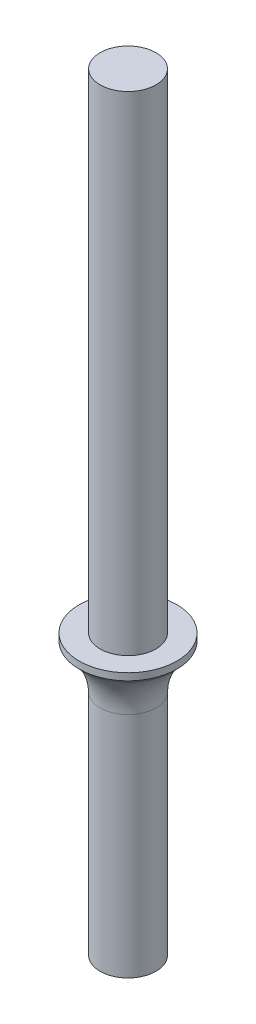
from build123d import *

# Parameters (mm, degrees)
SKETCH1_R           = 4
BOSS_EXTRUDE1_DEPTH = 110
SKETCH2_R           = 7
BOSS_EXTRUDE2_DEPTH = 1
CHAMFER1_SIZE       = 3
FILLET1_R           = 8


with BuildPart() as part:
    # Sketch1 → Boss-Extrude1 (new body)
    with BuildSketch(Plane(origin=(0, 0, 0), x_dir=(1, 0, 0), z_dir=(0, 1, 0))):
        with Locations(Location((0, 0, 0), (0, 0, 270))):
            Circle(SKETCH1_R)
    extrude(amount=BOSS_EXTRUDE1_DEPTH)

    # Sketch2 → Boss-Extrude2 (add)
    with BuildSketch(Plane(origin=(0, 39, 0), x_dir=(-1, 0, 0), z_dir=(0, -1, 0))):
        with Locations(Location((0, 0, 0), (0, 0, 90))):
            Circle(SKETCH2_R)
    extrude(amount=-BOSS_EXTRUDE2_DEPTH)

    # Chamfer1
    chamfer1_edges = [part.edges().sort_by_distance(p)[0] for p in [
        (0, 39, -4),
    ]]
    chamfer(chamfer1_edges, length=CHAMFER1_SIZE - 0.0001)  # a hair under: the kernel refuses the full size

    # Fillet1
    fillet1_edges = [part.edges().sort_by_distance(p)[0] for p in [
        (0, 36.0001, -4),
    ]]
    fillet(fillet1_edges, radius=FILLET1_R)


solid = part.part
